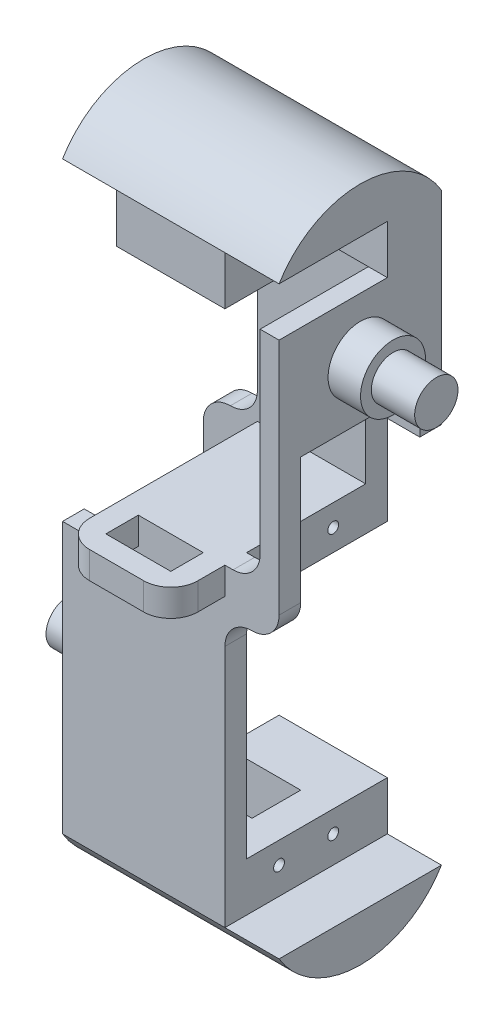
from build123d import *

# Parameters (mm, degrees)
SKETCH1_W                    = 20
SKETCH1_H                    = 30
BOSS_EXTRUDE1_DEPTH          = 8
SKETCH2_R                    = 1
CUT_EXTRUDE1_DEPTH           = 27.248809497
SKETCH3_W                    = 20
SKETCH3_H                    = 4
BOSS_EXTRUDE2_DEPTH          = 50
SKETCH4_W                    = 20
SKETCH4_H                    = 9
BOSS_EXTRUDE3_DEPTH          = 20
SKETCH5_W                    = 5
SKETCH5_H                    = 9
CUT_EXTRUDE2_DEPTH           = 20
SKETCH6_W                    = 9
SKETCH6_H                    = 9
CUT_EXTRUDE3_DEPTH           = 20
SKETCH7_W                    = 20
SKETCH7_H                    = 9
BOSS_EXTRUDE4_DEPTH          = 6
SKETCH8_W                    = 20
SKETCH8_H                    = 4
BOSS_EXTRUDE5_DEPTH          = 50
SKETCH9_W                    = 20
SKETCH9_H                    = 9
BOSS_EXTRUDE6_DEPTH          = 26
CUT_EXTRUDE4_REACH           = 111.494
SKETCH10_W                   = 14
SKETCH10_H                   = 9
SKETCH11_W                   = 4
SKETCH11_H                   = 8
BOSS_EXTRUDE7_DEPTH          = 10
SKETCH12_W                   = 3.5
SKETCH12_H                   = 20.7
BOSS_EXTRUDE8_DEPTH          = 26
BOSS_EXTRUDE9_REACH          = 84.194
SKETCH13_W                   = 3.5
SKETCH13_H                   = 4
SKETCH14_W                   = 1.495344936
SKETCH14_H                   = 11
BOSS_EXTRUDE10_DEPTH         = 9
SKETCH15_W                   = 11
SKETCH15_H                   = 0.013273072
BOSS_EXTRUDE11_DEPTH         = 9.075671666
SKETCH16_R                   = 4
BOSS_EXTRUDE12_DEPTH         = 14
SKETCH17_W                   = 4
SKETCH17_H                   = 8
BOSS_EXTRUDE13_DEPTH         = 10
BOSS_EXTRUDE14_REACH         = 74.083
SKETCH18_W                   = 3.5
SKETCH18_H                   = 20.7
BOSS_EXTRUDE15_REACH         = 70.884
SKETCH19_W                   = 3.5
SKETCH19_H                   = 4
SKETCH20_R                   = 4
BOSS_EXTRUDE16_DEPTH         = 14
SKETCH21_R                   = 1
CUT_EXTRUDE5_DEPTH           = 6
CUT_EXTRUDE5_DRAFT           = -1
CUT_EXTRUDE5_PROFILE_2_DEPTH = 6
CUT_EXTRUDE5_PROFILE_2_DRAFT = -1
SKETCH22_R                   = 1
CUT_EXTRUDE6_DEPTH           = 6
CUT_EXTRUDE6_DRAFT           = -1
CUT_EXTRUDE6_PROFILE_2_DEPTH = 6
CUT_EXTRUDE6_PROFILE_2_DRAFT = -1
FILLET2_START                = -15
FILLET2_DEPTH                = 31
FILLET2_2_DEPTH              = 4
FILLET2_START_2              = 11
FILLET2_3_DEPTH              = 4
BOSS_EXTRUDE18_DEPTH         = 20
BOSS_EXTRUDE19_DEPTH         = 20
SKETCH26_W                   = 10.666488476
SKETCH26_H                   = 15.41081711
CUT_EXTRUDE7_DEPTH           = 10
CUT_EXTRUDE8_DEPTH           = 81.481674045
CUT_EXTRUDE8_DEPTH_BACK      = 4
SKETCH28_W                   = 13.079869273
SKETCH28_H                   = 27.565671677
BOSS_EXTRUDE20_DEPTH         = 10
BOSS_EXTRUDE21_DEPTH         = 10
SKETCH31_R                   = 6
BOSS_EXTRUDE22_DEPTH         = 6
SKETCH32_R                   = 6
BOSS_EXTRUDE23_DEPTH         = 6
BOSS_EXTRUDE24_START         = 10
BOSS_EXTRUDE24_DEPTH         = 10
BOSS_EXTRUDE25_START         = 10
BOSS_EXTRUDE25_DEPTH         = 10
SKETCH35_W                   = 4
SKETCH35_H                   = 5
BOSS_EXTRUDE26_DEPTH         = 10
SKETCH36_W                   = 4
SKETCH36_H                   = 5
BOSS_EXTRUDE27_DEPTH         = 16
SKETCH37_W                   = 4
SKETCH37_H                   = 5
BOSS_EXTRUDE28_DEPTH         = 6
FILLET4_R                    = 5


with BuildPart() as part:
    # Sketch1 → Boss-Extrude1 (new body)
    with BuildSketch(Plane(origin=(0, 0, 0), x_dir=(1, 0, 0), z_dir=(0, 1, 0))):
        Rectangle(SKETCH1_W, SKETCH1_H)
    extrude(amount=BOSS_EXTRUDE1_DEPTH)

    # Sketch2 → Cut-Extrude1 (cut, through all)
    with BuildSketch(Plane(origin=(10, 0, 0), x_dir=(0, 0, -1), z_dir=(1, 0, 0))):
        with Locations((-5, 4)):
            Circle(SKETCH2_R)
        with Locations((5, 4)):
            Circle(SKETCH2_R)
    extrude(amount=-CUT_EXTRUDE1_DEPTH, mode=Mode.SUBTRACT)

    # Sketch3 → Boss-Extrude2 (add)
    with BuildSketch(Plane.XZ):
        with Locations((0, 13)):
            Rectangle(SKETCH3_W, SKETCH3_H)
    extrude(amount=BOSS_EXTRUDE2_DEPTH)

    # Sketch4 → Boss-Extrude3 (add)
    with BuildSketch(Plane(origin=(0, 0, 11), x_dir=(-1, 0, 0), z_dir=(0, 0, -1))):
        with Locations((0, -45.5)):
            Rectangle(SKETCH4_W, SKETCH4_H)
    extrude(amount=BOSS_EXTRUDE3_DEPTH)

    # Sketch5 → Cut-Extrude2 (cut)
    with BuildSketch(Plane.XZ.offset(50)):
        with Locations((-7.5, -0.5)):
            Rectangle(SKETCH5_W, SKETCH5_H)
    extrude(amount=-CUT_EXTRUDE2_DEPTH, mode=Mode.SUBTRACT)

    # Sketch6 → Cut-Extrude3 (cut)
    with BuildSketch(Plane.XZ.offset(50)):
        with Locations((-0.5, -0.5)):
            Rectangle(SKETCH6_W, SKETCH6_H)
    extrude(amount=-CUT_EXTRUDE3_DEPTH, mode=Mode.SUBTRACT)

    # Sketch7 → Boss-Extrude4 (add)
    with BuildSketch(Plane(origin=(0, 0, -9), x_dir=(-1, 0, 0), z_dir=(0, 0, -1))):
        with Locations((0, -45.5)):
            Rectangle(SKETCH7_W, SKETCH7_H)
    extrude(amount=BOSS_EXTRUDE4_DEPTH)

    # Sketch8 → Boss-Extrude5 (add)
    with BuildSketch(Plane(origin=(0, 8, 0), x_dir=(1, 0, 0), z_dir=(0, 1, 0))):
        with Locations((0, 13)):
            Rectangle(SKETCH8_W, SKETCH8_H)
    extrude(amount=BOSS_EXTRUDE5_DEPTH)

    # Sketch9 → Boss-Extrude6 (add)
    with BuildSketch(Plane.XY.offset(-11)):
        with Locations((0, 53.5)):
            Rectangle(SKETCH9_W, SKETCH9_H)
    extrude(amount=BOSS_EXTRUDE6_DEPTH)

    # Sketch10 → Cut-Extrude4 (cut, up to next)
    with BuildSketch(Plane(origin=(0, 58, 0), x_dir=(1, 0, 0), z_dir=(0, 1, 0)), mode=Mode.PRIVATE) as cut_extrude4_sk1:
        with Locations((3, 0.5)):
            Rectangle(SKETCH10_W, SKETCH10_H)
    cut_extrude4_tool1 = extrude(cut_extrude4_sk1.sketch, amount=-CUT_EXTRUDE4_REACH, mode=Mode.PRIVATE) & part.part
    add(cut_extrude4_tool1.solids().sort_by_distance((3, 58, -0.5))[0], mode=Mode.SUBTRACT)

    # Sketch11 → Boss-Extrude7 (add)
    with BuildSketch(Plane.ZY.offset(10)):
        Polygon((4, -41), (11, -41), (11, 8), (15, 8), (15, -41), (15, -49.986726928), (4, -49.986726928), align=None)
        with Locations((-13, 4)):
            Rectangle(SKETCH11_W, SKETCH11_H)
    extrude(amount=BOSS_EXTRUDE7_DEPTH)

    # Sketch12 → Boss-Extrude8 (add)
    with BuildSketch(Plane(origin=(0, 0, 11), x_dir=(-1, 0, 0), z_dir=(0, 0, -1))):
        with Locations((18.25, -30.65)):
            Rectangle(SKETCH12_W, SKETCH12_H)
    extrude(amount=BOSS_EXTRUDE8_DEPTH)

    # Sketch13 → Boss-Extrude9 (add, up to next)
    with BuildSketch(Plane(origin=(0, -20.3, 0), x_dir=(1, 0, 0), z_dir=(0, 1, 0)), mode=Mode.PRIVATE) as boss_extrude9_sk1:
        with Locations((-18.25, 13)):
            Rectangle(SKETCH13_W, SKETCH13_H)
    boss_extrude9_tool1 = extrude(boss_extrude9_sk1.sketch, amount=BOSS_EXTRUDE9_REACH, mode=Mode.PRIVATE) - part.part
    add(boss_extrude9_tool1.solids().sort_by_distance((-18.25, -20.3, -13))[0])

    # Sketch14 → Boss-Extrude10 (add)
    with BuildSketch(Plane.XZ.offset(50)):
        with Locations((-10.176655866, 9.5)):
            Rectangle(SKETCH14_W, SKETCH14_H)
    extrude(amount=-BOSS_EXTRUDE10_DEPTH)

    # Sketch15 → Boss-Extrude11 (add)
    with BuildSketch(Plane.ZY.offset(10.924328334)):
        with Locations((9.5, -49.993363464)):
            Rectangle(SKETCH15_W, SKETCH15_H)
    extrude(amount=BOSS_EXTRUDE11_DEPTH)

    # Sketch16 → Boss-Extrude12 (add)
    with BuildSketch(Plane.ZY.offset(20)):
        with Locations((0.05, -30.5)):
            Circle(SKETCH16_R)
    extrude(amount=BOSS_EXTRUDE12_DEPTH)

    # Sketch17 → Boss-Extrude13 (add)
    with BuildSketch(Plane(origin=(10, 0, 0), x_dir=(0, 0, -1), z_dir=(1, 0, 0))):
        Polygon((5, 58), (15, 58), (15, 49), (15, 0), (11, 0), (11, 49), (5, 49), align=None)
        with Locations((-13, 4)):
            Rectangle(SKETCH17_W, SKETCH17_H)
    extrude(amount=BOSS_EXTRUDE13_DEPTH)

    # Boss-Extrude14: up to this face of the body (flat: up to its plane)
    boss_extrude14_end = Plane(part.part.faces().sort_by_distance((0, 53.5, 15))[0])
    # Sketch18 → Boss-Extrude14 (add, up to the picked face)
    with BuildSketch(Plane.XY.offset(-11), mode=Mode.PRIVATE) as boss_extrude14_sk1:
        with Locations((18.25, 38.65)):
            Rectangle(SKETCH18_W, SKETCH18_H)
    boss_extrude14_tool1 = split(extrude(boss_extrude14_sk1.sketch, amount=BOSS_EXTRUDE14_REACH, mode=Mode.PRIVATE), bisect_by=boss_extrude14_end, keep=Keep.BOTH, mode=Mode.PRIVATE)
    add(boss_extrude14_tool1.solids().sort_by(Axis((18.25, 38.65, -11), (0, 0, 1)))[0])

    # Sketch19 → Boss-Extrude15 (add, up to next)
    with BuildSketch(Plane(origin=(0, 8, 0), x_dir=(1, 0, 0), z_dir=(0, 1, 0)), mode=Mode.PRIVATE) as boss_extrude15_sk1:
        with Locations((18.25, -13)):
            Rectangle(SKETCH19_W, SKETCH19_H)
    boss_extrude15_tool1 = extrude(boss_extrude15_sk1.sketch, amount=BOSS_EXTRUDE15_REACH, mode=Mode.PRIVATE) - part.part
    add(boss_extrude15_tool1.solids().sort_by_distance((18.25, 8, 13))[0])

    # Sketch20 → Boss-Extrude16 (add)
    with BuildSketch(Plane(origin=(20, 0, 0), x_dir=(0, 0, -1), z_dir=(1, 0, 0))):
        with Locations((0.05, 38.5)):
            Circle(SKETCH20_R)
    extrude(amount=BOSS_EXTRUDE16_DEPTH)


with BuildPart() as cut_extrude5_tool:
    # Sketch21 → Cut-Extrude5 (with draft: the straight prism first)
    with BuildSketch(Plane(origin=(10, 0, 0), x_dir=(0, 0, -1), z_dir=(1, 0, 0))):
        with Locations((-5, -45)):
            Circle(SKETCH21_R)
    extrude(amount=-CUT_EXTRUDE5_DEPTH)
    # Cut-Extrude5: the draft: its side faces are tilted about the plane it starts from
    cut_extrude5_sides = [cut_extrude5_tool.faces().sort_by_distance(p)[0] for p in [
        (7, -45, 6),
    ]]
    draft(cut_extrude5_sides, Plane(origin=(10, 0, 0), x_dir=(0, 0, -1), z_dir=(1, 0, 0)), CUT_EXTRUDE5_DRAFT)


with BuildPart() as part_1:
    add(part.part)

    # Cut-Extrude5: cut by cut_extrude5_tool
    add(cut_extrude5_tool.part, mode=Mode.SUBTRACT)


with BuildPart() as cut_extrude5_profile_2_tool:
    # Sketch21 → Cut-Extrude5 profile 2 (with draft: the straight prism first)
    with BuildSketch(Plane(origin=(10, 0, 0), x_dir=(0, 0, -1), z_dir=(1, 0, 0))):
        with Locations((5, -45)):
            Circle(SKETCH21_R)
    extrude(amount=-CUT_EXTRUDE5_PROFILE_2_DEPTH)
    # Cut-Extrude5 profile 2: the draft: its side faces are tilted about the plane it starts from
    cut_extrude5_profile_2_sides = [cut_extrude5_profile_2_tool.faces().sort_by_distance(p)[0] for p in [
        (7, -45, -4),
    ]]
    draft(cut_extrude5_profile_2_sides, Plane(origin=(10, 0, 0), x_dir=(0, 0, -1), z_dir=(1, 0, 0)), CUT_EXTRUDE5_PROFILE_2_DRAFT)


with BuildPart() as part_2:
    add(part_1.part)

    # Cut-Extrude5 profile 2: cut by cut_extrude5_profile_2_tool
    add(cut_extrude5_profile_2_tool.part, mode=Mode.SUBTRACT)


with BuildPart() as cut_extrude6_tool:
    # Sketch22 → Cut-Extrude6 (with draft: the straight prism first)
    with BuildSketch(Plane.ZY.offset(10)):
        with Locations((-5, 53)):
            Circle(SKETCH22_R)
    extrude(amount=-CUT_EXTRUDE6_DEPTH)
    # Cut-Extrude6: the draft: its side faces are tilted about the plane it starts from
    cut_extrude6_sides = [cut_extrude6_tool.faces().sort_by_distance(p)[0] for p in [
        (-7, 53, -6),
    ]]
    draft(cut_extrude6_sides, Plane.ZY.offset(10), CUT_EXTRUDE6_DRAFT)


with BuildPart() as part_3:
    add(part_2.part)

    # Cut-Extrude6: cut by cut_extrude6_tool
    add(cut_extrude6_tool.part, mode=Mode.SUBTRACT)


with BuildPart() as cut_extrude6_profile_2_tool:
    # Sketch22 → Cut-Extrude6 profile 2 (with draft: the straight prism first)
    with BuildSketch(Plane.ZY.offset(10)):
        with Locations((5, 53)):
            Circle(SKETCH22_R)
    extrude(amount=-CUT_EXTRUDE6_PROFILE_2_DEPTH)
    # Cut-Extrude6 profile 2: the draft: its side faces are tilted about the plane it starts from
    cut_extrude6_profile_2_sides = [cut_extrude6_profile_2_tool.faces().sort_by_distance(p)[0] for p in [
        (-7, 53, 4),
    ]]
    draft(cut_extrude6_profile_2_sides, Plane.ZY.offset(10), CUT_EXTRUDE6_PROFILE_2_DRAFT)


with BuildPart() as part_4:
    add(part_3.part)

    # Cut-Extrude6 profile 2: cut by cut_extrude6_profile_2_tool
    add(cut_extrude6_profile_2_tool.part, mode=Mode.SUBTRACT)

    # Fillet2: read off the stored shape, not the designer's step
    # Fillet2 outline → Fillet2 (cut)
    with BuildSketch(Plane.XY.offset(FILLET2_START)):
        with BuildLine():
            ThreePointArc((-20, 3), (-18.535533906, 6.535533906), (-15, 8))
            Line((-15, 8), (-20, 8))
            Line((-20, 8), (-20, 3))
        make_face()
        with BuildLine():
            ThreePointArc((20, 5), (18.535533906, 1.464466094), (15, 0))
            Line((15, 0), (20, 0))
            Line((20, 0), (20, 5))
        make_face()
    extrude(amount=FILLET2_DEPTH, mode=Mode.SUBTRACT)

    # Fillet2 2 outline → Fillet2 2 (add)
    with BuildSketch(Plane.XY.offset(FILLET2_START)):
        with BuildLine():
            Line((-15, 8), (-10, 8))
            Line((-10, 8), (-10, 13))
            ThreePointArc((-10, 13), (-11.464466094, 9.464466094), (-15, 8))
        make_face()
        with BuildLine():
            ThreePointArc((-16.5, -5), (-15.035533906, -1.464466094), (-11.5, 0))
            Line((-11.5, 0), (-16.5, 0))
            Line((-16.5, 0), (-16.5, -5))
        make_face()
    extrude(amount=FILLET2_2_DEPTH)

    # Fillet2 3 outline → Fillet2 3 (add)
    with BuildSketch(Plane.XY.offset(FILLET2_START_2)):
        with BuildLine():
            ThreePointArc((16.5, 13), (15.035533906, 9.464466094), (11.5, 8))
            Line((11.5, 8), (16.5, 8))
            Line((16.5, 8), (16.5, 13))
        make_face()
        with BuildLine():
            Line((15, 0), (10, 0))
            Line((10, 0), (10, -5))
            ThreePointArc((10, -5), (11.464466094, -1.464466094), (15, 0))
        make_face()
    extrude(amount=FILLET2_3_DEPTH)

    # Sketch25 → Boss-Extrude19 (add)
    with BuildSketch(Plane.ZY.offset(10)):
        with BuildLine():
            Line((-15, 58), (15, 58))
            ThreePointArc((15, 58), (0, 66.492855685), (-15, 58))
        make_face()
    extrude(amount=-BOSS_EXTRUDE19_DEPTH)

    # Sketch26 → Cut-Extrude7 (cut)
    with BuildSketch(Plane(origin=(0, 0, 11), x_dir=(-1, 0, 0), z_dir=(0, 0, -1))):
        with Locations((15.333244238, 7.705408555)):
            Rectangle(SKETCH26_W, SKETCH26_H)
    extrude(amount=-CUT_EXTRUDE7_DEPTH, mode=Mode.SUBTRACT)

    # Sketch28 → Cut-Extrude8 (cut, two sides: drawn at the far end of the back side and taken through both)
    with BuildSketch(Plane(origin=(0, 0, -15), x_dir=(-1, 0, 0), z_dir=(0, 0, -1)).offset(-CUT_EXTRUDE8_DEPTH_BACK)):
        with Locations((-16.539934636, 6.697724659)):
            Rectangle(SKETCH28_W, SKETCH28_H)
    extrude(amount=CUT_EXTRUDE8_DEPTH + CUT_EXTRUDE8_DEPTH_BACK, mode=Mode.SUBTRACT)

    # Sketch29 → Boss-Extrude20 (add)
    with BuildSketch(Plane(origin=(10, 0, 0), x_dir=(0, 0, -1), z_dir=(1, 0, 0))):
        with BuildLine():
            Line((-4, 58), (-3.362558036, 58))
            Line((-3.362558036, 58), (5, 58))
            Line((5, 58), (15, 58))
            ThreePointArc((15, 58), (0, 66.492855685), (-15, 58))
            Line((-15, 58), (-4, 58))
        make_face()
    extrude(amount=BOSS_EXTRUDE20_DEPTH)



with BuildPart() as body_2:
    # Sketch24 → Boss-Extrude18 (new body)
    with BuildSketch(Plane(origin=(10, 0, 0), x_dir=(0, 0, -1), z_dir=(1, 0, 0))):
        with BuildLine():
            Line((-15, -50), (15, -50))
            ThreePointArc((15, -50), (0, -58.492855685), (-15, -50))
        make_face()
    extrude(amount=-BOSS_EXTRUDE18_DEPTH)


with BuildPart() as part_5:
    add(part_4.part)

    add(body_2.part)  # Boss-Extrude21 merges body 2
    # Sketch30 → Boss-Extrude21 (add)
    with BuildSketch(Plane.ZY.offset(10)):
        with BuildLine():
            Line((-15, -50), (15, -50))
            ThreePointArc((15, -50), (0, -58.492855685), (-15, -50))
        make_face()
    extrude(amount=BOSS_EXTRUDE21_DEPTH)

    # Sketch31 → Boss-Extrude22 (add)
    with BuildSketch(Plane.ZY.offset(20)):
        with Locations((0.05, -30.5)):
            Circle(SKETCH31_R)
    extrude(amount=BOSS_EXTRUDE22_DEPTH)

    # Sketch32 → Boss-Extrude23 (add)
    with BuildSketch(Plane(origin=(20, 0, 0), x_dir=(0, 0, -1), z_dir=(1, 0, 0))):
        with Locations((0.05, 38.5)):
            Circle(SKETCH32_R)
    extrude(amount=BOSS_EXTRUDE23_DEPTH)

    # Sketch33 → Boss-Extrude24 (add)
    with BuildSketch(Plane(origin=(10, 0, 0), x_dir=(0, 0, -1), z_dir=(1, 0, 0)).offset(BOSS_EXTRUDE24_START)):
        with BuildLine():
            Line((-15, -50), (15, -50))
            ThreePointArc((15, -50), (0, -58.492855685), (-15, -50))
        make_face()
    extrude(amount=-BOSS_EXTRUDE24_DEPTH)

    # Sketch34 → Boss-Extrude25 (add)
    with BuildSketch(Plane.ZY.offset(10).offset(BOSS_EXTRUDE25_START)):
        with BuildLine():
            Line((-15, 58), (15, 58))
            ThreePointArc((15, 58), (0, 66.492855685), (-15, 58))
        make_face()
    extrude(amount=-BOSS_EXTRUDE25_DEPTH)

    # Sketch35 → Boss-Extrude26 (add)
    with BuildSketch(Plane.XY.offset(15)):
        with Locations((-8, 5.5)):
            Rectangle(SKETCH35_W, SKETCH35_H)
    extrude(amount=BOSS_EXTRUDE26_DEPTH)

    # Sketch36 → Boss-Extrude27 (add)
    with BuildSketch(Plane(origin=(-6, 0, 0), x_dir=(0, 0, -1), z_dir=(1, 0, 0))):
        with Locations((-23, 5.5)):
            Rectangle(SKETCH36_W, SKETCH36_H)
    extrude(amount=BOSS_EXTRUDE27_DEPTH)

    # Sketch37 → Boss-Extrude28 (add)
    with BuildSketch(Plane(origin=(0, 0, 21), x_dir=(-1, 0, 0), z_dir=(0, 0, -1))):
        with Locations((-8, 5.5)):
            Rectangle(SKETCH37_W, SKETCH37_H)
    extrude(amount=BOSS_EXTRUDE28_DEPTH)

    # Fillet4
    fillet4_edges = [part_5.edges().sort_by_distance(p)[0] for p in [
        (-10, 5.5, 25),
        (10, 5.5, 25),
    ]]
    fillet(fillet4_edges, radius=FILLET4_R)


solid = part_5.part
